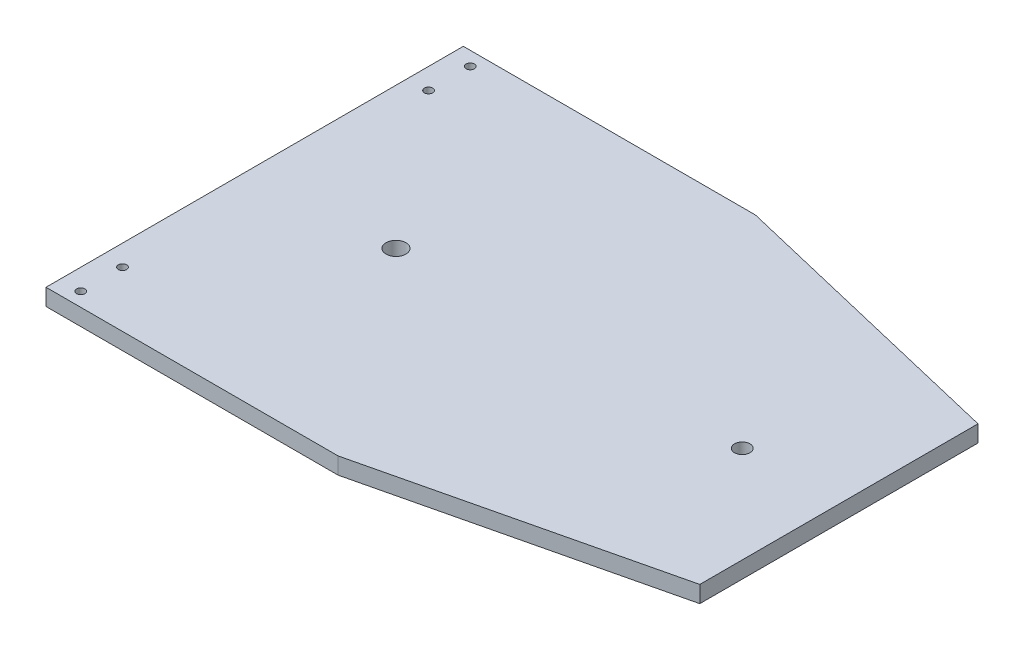
from build123d import *

# Parameters (mm, degrees)
ESBO_O1_R                = 3.571875
ESBO_O1_R_2              = 2.778125
ESBO_O1_R_3              = 1.5
RESSALTO_EXTRUS_O1_DEPTH = 6


with BuildPart() as part:
    # Esboço1 → Ressalto-extrusão1 (new body)
    with BuildSketch(Plane(origin=(0, 0, 0), x_dir=(1, 0, 0), z_dir=(0, 1, 0))):
        Polygon((210, 50), (105, 75), (0, 75), (0, -75), (105, -75), (210, -50), align=None)
        with Locations((50.8, 0)):
            Circle(ESBO_O1_R, mode=Mode.SUBTRACT)
        with Locations((175.26, 0)):
            Circle(ESBO_O1_R_2, mode=Mode.SUBTRACT)
        with Locations((7.5, -70)):
            Circle(ESBO_O1_R_3, mode=Mode.SUBTRACT)
        with Locations((7.5, -55)):
            Circle(ESBO_O1_R_3, mode=Mode.SUBTRACT)
        with Locations((7.5, 55)):
            Circle(ESBO_O1_R_3, mode=Mode.SUBTRACT)
        with Locations((7.5, 70)):
            Circle(ESBO_O1_R_3, mode=Mode.SUBTRACT)
    extrude(amount=RESSALTO_EXTRUS_O1_DEPTH)


solid = part.part
